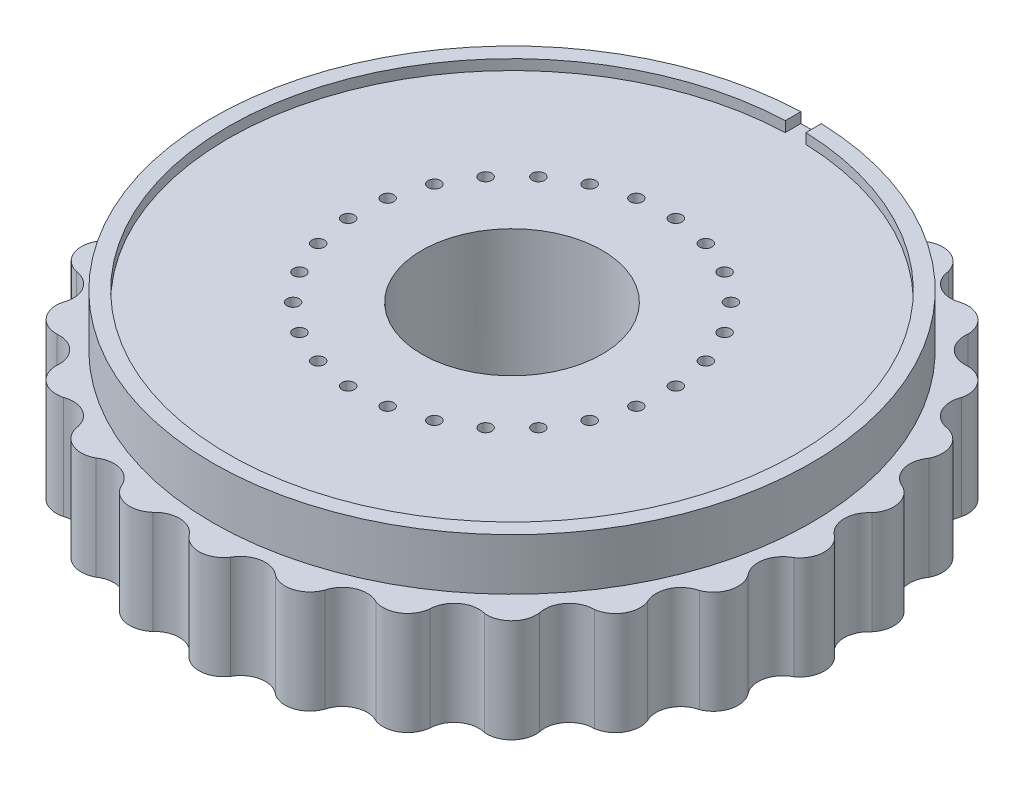
from build123d import *

# Parameters (mm, degrees)
EXTRUDE_WHEEL_DEPTH        = 10
CIRPATTERN1_COUNT          = 26
SKETCH4_R                  = 29
BOSS_EXTRUDE1_DEPTH        = 5
BEARING_HOLE_R             = 8.73125
CUT_BEARING_HOLE_DEPTH     = 48.798947189
PCB_INSET_CUT_DEPTH        = 1
PCB_START                  = -1
PCB_INSET_CUT_2_DEPTH      = 1
PCB_OUTPUT_HOLES_R         = 0.6
PCB_OUTPUT_HOLES_CUT_DEPTH = 48.494624458


with BuildPart() as part:
    # Wheel → Extrude wheel (new body)
    with BuildSketch(Plane(origin=(0, 0, 0), x_dir=(1, 0, 0), z_dir=(0, 1, 0))):
        with BuildLine():
            Line((0, 0), (29.128254523, 7.179469929))
            Line((29.128254523, 7.179469929), (30.341931795, 7.478614509))
            ThreePointArc((30.341931795, 7.478614509), (31.616410176, 5.808198613), (31.087663821, 3.774725795))
            ThreePointArc((31.087663821, 3.774725795), (30.249976155, 1.847846509), (31.25, 0))
            Line((31.25, 0), (30, 0))
            Line((30, 0), (0, 0))
        make_face()
    extrude_wheel = extrude(amount=EXTRUDE_WHEEL_DEPTH)

    # CirPattern1: Extrude wheel ×26 about axis
    cirpattern1_axis = Axis((0, 10, 0), (0, -1, 0))
    for i in range(1, CIRPATTERN1_COUNT):
        add(extrude_wheel.rotate(cirpattern1_axis, i * 360 / CIRPATTERN1_COUNT))

    # Sketch4 → Boss-Extrude1 (add)
    with BuildSketch(Plane(origin=(0, 10, 0), x_dir=(1, 0, 0), z_dir=(0, 1, 0))):
        Circle(SKETCH4_R)
    extrude(amount=BOSS_EXTRUDE1_DEPTH)

    # Bearing hole → Cut bearing hole (cut, through all)
    with BuildSketch(Plane(origin=(0, 15, 0), x_dir=(1, 0, 0), z_dir=(0, 1, 0))):
        Circle(BEARING_HOLE_R)
    extrude(amount=-CUT_BEARING_HOLE_DEPTH, mode=Mode.SUBTRACT)

    # PCB inset → PCB inset cut (cut)
    with BuildSketch(Plane(origin=(0, 15, 0), x_dir=(1, 0, 0), z_dir=(0, 1, 0))):
        with BuildLine():
            Line((-1, 27.481812167), (-1, 29.481812167))
            Line((-1, 29.481812167), (1, 29.481812167))
            Line((1, 29.481812167), (1, 27.481812167))
            ThreePointArc((1, 27.481812167), (0, -27.5), (-1, 27.481812167))
        make_face()
    extrude(amount=-PCB_INSET_CUT_DEPTH, mode=Mode.SUBTRACT)

    # PCB inset 2 → PCB inset cut 2 (cut)
    with BuildSketch(Plane.XZ.offset(PCB_START)):
        with BuildLine():
            Line((1, -27.481812167), (1, -29.481812167))
            Line((1, -29.481812167), (-1, -29.481812167))
            Line((-1, -29.481812167), (-1, -27.481812167))
            ThreePointArc((-1, -27.481812167), (0, 27.5), (1, -27.481812167))
        make_face()
    extrude(amount=PCB_INSET_CUT_2_DEPTH, mode=Mode.SUBTRACT)

    # PCB output holes → PCB output holes cut (cut, through all)
    with BuildSketch(Plane(origin=(0, 14, 0), x_dir=(1, 0, 0), z_dir=(0, 1, 0))):
        with Locations((14.972633313, 0.905677461)):
            Circle(PCB_OUTPUT_HOLES_R)
        with Locations((14.754298604, -2.703825567)):
            Circle(PCB_OUTPUT_HOLES_R)
        with Locations((13.67849769, -6.156192082)):
            Circle(PCB_OUTPUT_HOLES_R)
        with Locations((11.807752209, -9.250783089)):
            Circle(PCB_OUTPUT_HOLES_R)
        with Locations((9.250783089, -11.807752209)):
            Circle(PCB_OUTPUT_HOLES_R)
        with Locations((6.156192082, -13.67849769)):
            Circle(PCB_OUTPUT_HOLES_R)
        with Locations((2.703825567, -14.754298604)):
            Circle(PCB_OUTPUT_HOLES_R)
        with Locations((-0.905677461, -14.972633313)):
            Circle(PCB_OUTPUT_HOLES_R)
        with Locations((-4.462545808, -14.320812998)):
            Circle(PCB_OUTPUT_HOLES_R)
        with Locations((-7.760067213, -12.836719085)):
            Circle(PCB_OUTPUT_HOLES_R)
        with Locations((-10.606601718, -10.606601718)):
            Circle(PCB_OUTPUT_HOLES_R)
        with Locations((-12.836719085, -7.760067213)):
            Circle(PCB_OUTPUT_HOLES_R)
        with Locations((-14.320812998, -4.462545808)):
            Circle(PCB_OUTPUT_HOLES_R)
        with Locations((-14.972633313, -0.905677461)):
            Circle(PCB_OUTPUT_HOLES_R)
        with Locations((-14.754298604, 2.703825567)):
            Circle(PCB_OUTPUT_HOLES_R)
        with Locations((-13.67849769, 6.156192082)):
            Circle(PCB_OUTPUT_HOLES_R)
        with Locations((-11.807752209, 9.250783089)):
            Circle(PCB_OUTPUT_HOLES_R)
        with Locations((-9.250783089, 11.807752209)):
            Circle(PCB_OUTPUT_HOLES_R)
        with Locations((-6.156192082, 13.67849769)):
            Circle(PCB_OUTPUT_HOLES_R)
        with Locations((-2.703825567, 14.754298604)):
            Circle(PCB_OUTPUT_HOLES_R)
        with Locations((0.905677461, 14.972633313)):
            Circle(PCB_OUTPUT_HOLES_R)
        with Locations((4.462545808, 14.320812998)):
            Circle(PCB_OUTPUT_HOLES_R)
        with Locations((7.760067213, 12.836719085)):
            Circle(PCB_OUTPUT_HOLES_R)
        with Locations((10.606601718, 10.606601718)):
            Circle(PCB_OUTPUT_HOLES_R)
        with Locations((12.836719085, 7.760067213)):
            Circle(PCB_OUTPUT_HOLES_R)
        with Locations((14.320812998, 4.462545808)):
            Circle(PCB_OUTPUT_HOLES_R)
    extrude(amount=-PCB_OUTPUT_HOLES_CUT_DEPTH, mode=Mode.SUBTRACT)


solid = part.part
